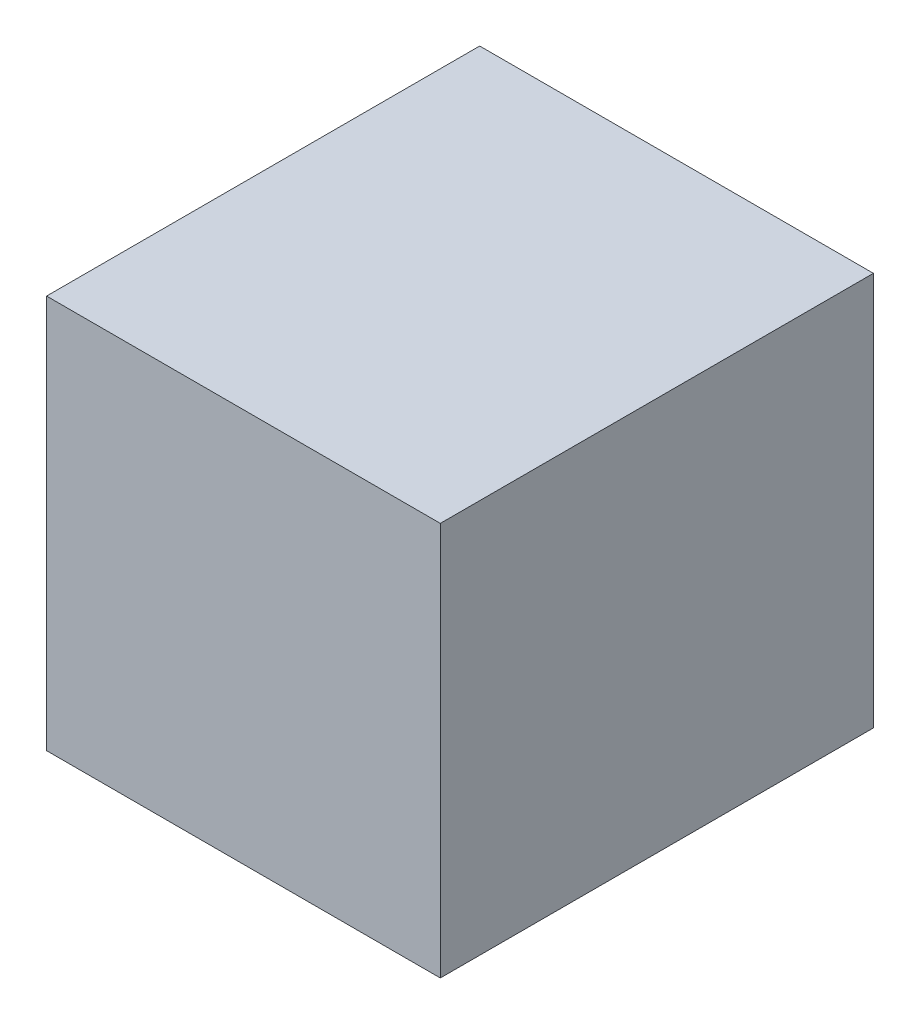
from build123d import *

# Parameters (mm, degrees)
SKETCH1_W           = 100
SKETCH1_H           = 100
BOSS_EXTRUDE1_DEPTH = 110


with BuildPart() as part:
    # Sketch1 → Boss-Extrude1 (new body)
    with BuildSketch(Plane.XY):
        Rectangle(SKETCH1_W, SKETCH1_H)
    extrude(amount=BOSS_EXTRUDE1_DEPTH)


solid = part.part
